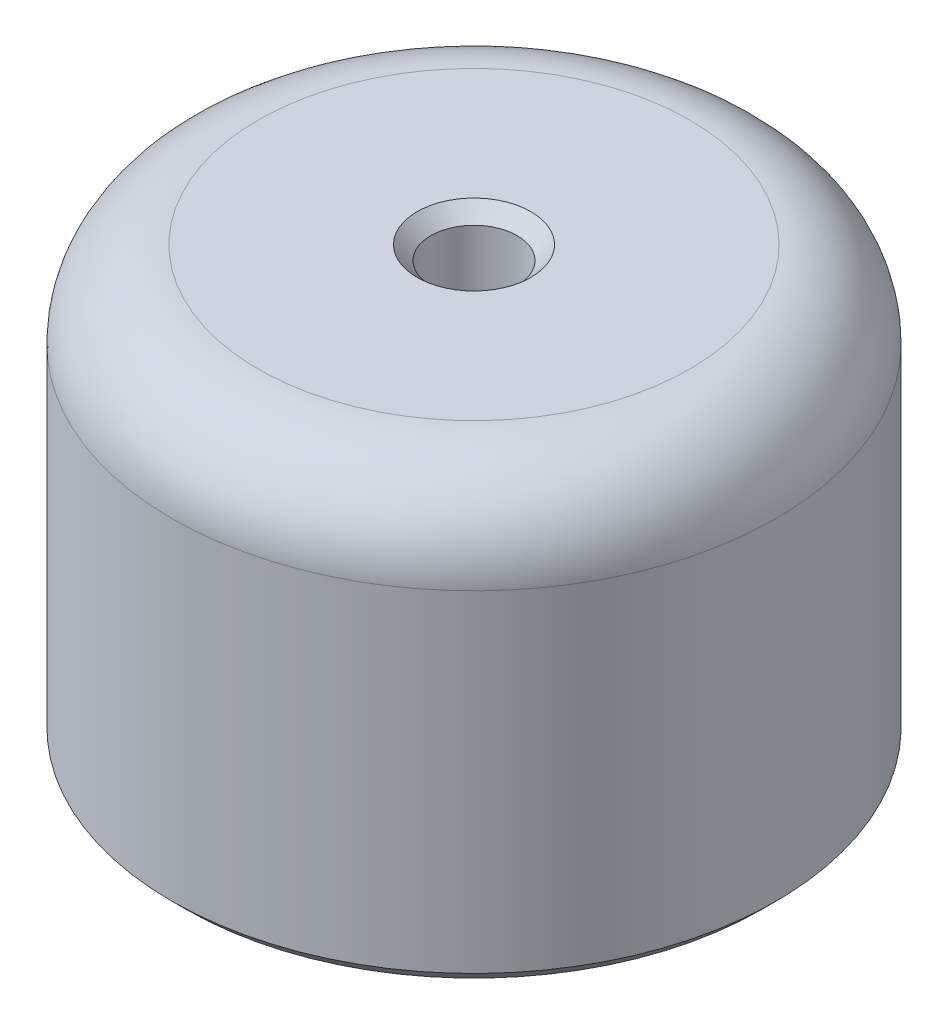
from build123d import *

# Parameters (mm, degrees)
FILLET1_R = 1.5875
FILLET2_R = 3.175


with BuildPart() as part:
    # Sketch1 → Revolve1 (revolve)
    with BuildSketch(Plane.XY, mode=Mode.PRIVATE) as revolve1_sk:
        Polygon((1.5875, 15.875), (1.5875, 12.7), (6.35, 12.7), (6.35, 7.9375), (7.9375, 7.9375), (7.9375, 0), (11.1125, 0), (11.1125, 15.875), align=None)
    revolve(revolve1_sk.sketch.rotate(Axis((0, 3.137063419, 0), (0, -1, 0)), 90), axis=Axis((0, 3.137063419, 0), (0, -1, 0)))

    # Fillet1
    fillet1_edges = [part.edges().sort_by_distance(p)[0] for p in [
        (0, 7.9375, -7.9375),
        (0, 12.7, -6.35),
    ]]
    fillet(fillet1_edges, radius=FILLET1_R - 0.0001)  # a hair under: the kernel refuses the full size

    # Fillet2
    fillet2_edges = [part.edges().sort_by_distance(p)[0] for p in [
        (0, 15.875, -11.1125),
    ]]
    fillet(fillet2_edges, radius=FILLET2_R)

    # Chamfer1: read off the stored shape, not the designer's step
    # Chamfer1 outline → Chamfer1 (revolve, cut)
    with BuildSketch(Plane.XY):
        Polygon((1.5875, 15.875), (1.5875, 15.367), (2.0955, 15.875), align=None)
        Polygon((2.0955, 12.7), (1.5875, 13.208), (1.5875, 12.7), align=None)
        Polygon((6.994887663, 7.800612337), (6.35, 8.4455), (6.35, 7.800612337), align=None)
        Polygon((8.4455, 0), (7.9375, 0.508), (7.9375, 0), align=None)
        Polygon((11.1125, 0.508), (10.6045, 0), (11.1125, 0), align=None)
    revolve(axis=Axis((0, 0, 0), (0, 1, 0)), mode=Mode.SUBTRACT)


solid = part.part
